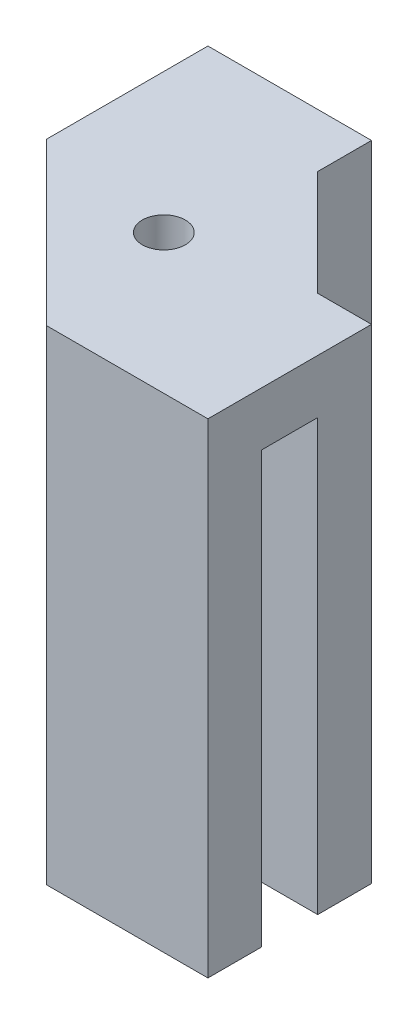
from build123d import *

# Parameters (mm, degrees)
BOSS_EXTRUDE1_DEPTH         = 50.8
TAP_DRILL_FOR_1_4_20_TAP1_D = 5.08
SKETCH4_R                   = 2.5399999999999947
BOSS_EXTRUDE2_DEPTH         = 6.35


with BuildPart() as part:
    # Sketch1 → Boss-Extrude1 (new body)
    with BuildSketch(Plane(origin=(0, 0, 0), x_dir=(1, 0, 0), z_dir=(0, 1, 0))):
        Polygon((22.098000000000056, 9.651999999999928), (9.652, 22.09800000000003), (9.652000000000001, 28.447999999999904), (3.3019999999999996, 28.447999999999904), (3.302000000000003, 15.747999999999971), (-3.3020000000000005, 15.747999999999967), (-3.3020000000000014, 28.447999999999904), (-9.652000000000001, 28.447999999999904), (-9.651999999999997, 9.397999999999907), (9.397999999999879, -9.652000000000031), (28.447999999999862, -9.652000000000092), (28.44799999999989, -3.3020000000001004), (15.747999999999957, -3.3020000000000556), (15.747999999999982, 3.3019999999999445), (28.447999999999915, 3.3019999999998992), (28.447999999999933, 9.65199999999991), align=None)
    extrude(amount=BOSS_EXTRUDE1_DEPTH)

    # Tap Drill for 1/4-20 Tap1 (through all)
    with Locations(Plane(origin=(0, 50.8, 0), x_dir=(1, 0, 0), z_dir=(0, 1, 0))):
        with Locations((6.795346667, 6.795346667)):
            Hole(TAP_DRILL_FOR_1_4_20_TAP1_D / 2)

    # Sketch4 → Boss-Extrude2 (add)
    with BuildSketch(Plane(origin=(0, 50.8, 0), x_dir=(1, 0, 0), z_dir=(0, 1, 0))):
        Polygon((-3.3020000000000014, 28.447999999999904), (3.3019999999999996, 28.447999999999904), (9.652000000000001, 28.447999999999904), (9.652, 22.09800000000003), (22.098000000000056, 9.651999999999928), (28.447999999999933, 9.65199999999991), (28.447999999999915, 3.3019999999998992), (28.44799999999989, -3.3020000000001004), (28.447999999999862, -9.652000000000092), (9.397999999999879, -9.652000000000031), (-9.651999999999997, 9.397999999999907), (-9.652000000000001, 28.447999999999904), align=None)
        with Locations((6.7953466666666715, 6.7953466666666476)):
            Circle(SKETCH4_R, mode=Mode.SUBTRACT)
    extrude(amount=BOSS_EXTRUDE2_DEPTH)


solid = part.part
